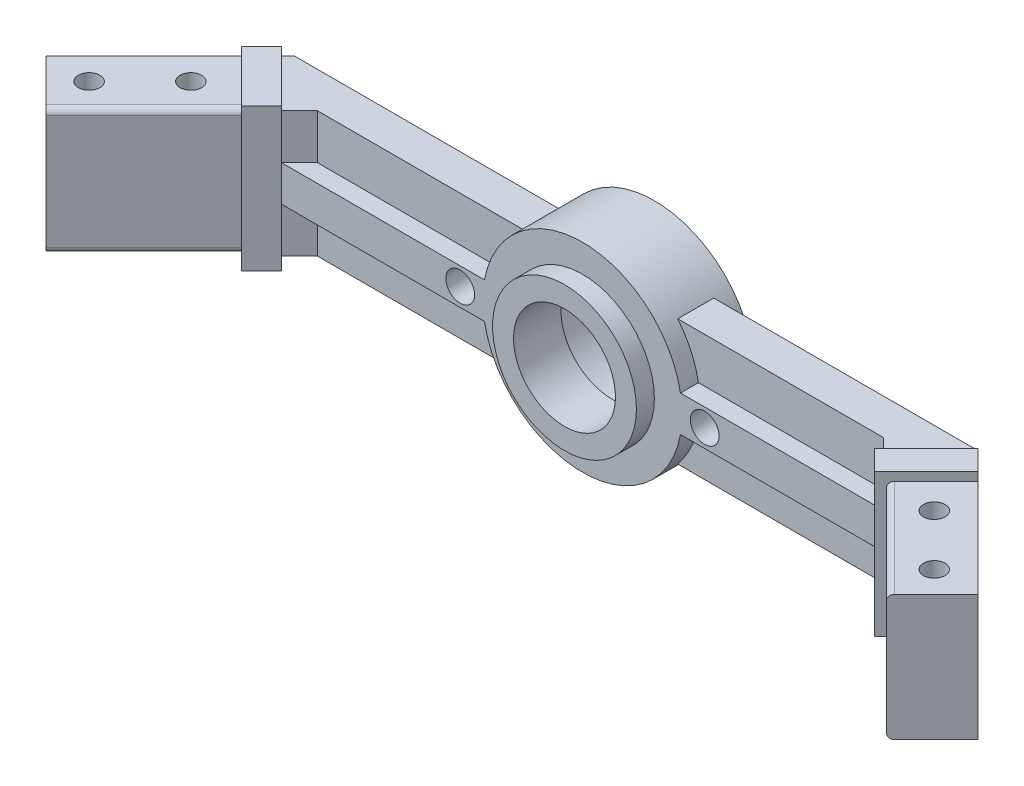
from build123d import *
from build123d.topology import SkipClean

# Parameters (mm, degrees)
BOSS_EXTRUDE1_DEPTH = 11.1125
SKETCH3_R           = 17.6
BOSS_EXTRUDE2_DEPTH = 12.7
SKETCH3_5_R         = 11.25
CUT_EXTRUDE2_DEPTH  = 7.5
SKETCH3_6_R         = 9
CUT_EXTRUDE3_DEPTH  = 12.7
BOSS_EXTRUDE3_START = -31.9278
BOSS_EXTRUDE3_DEPTH = 4.953
FILLET1_R           = 1.016
SKETCH5_R           = 1.905
CUT_EXTRUDE4_DEPTH  = 96.510603758
FILLET3_R           = 1.016
CUT_EXTRUDE5_START  = -3.175
CUT_EXTRUDE5_DEPTH  = 3.175
SKETCH9_W           = 10.961249955
SKETCH9_H           = 7.9375
CUT_EXTRUDE6_DEPTH  = 3.175
CUT_EXTRUDE9_DEPTH  = 2.54
SKETCH13_R          = 12.7
SKETCH13_R_2        = 9
BOSS_EXTRUDE6_DEPTH = 3.175
CHAMFER2_SIZE       = 3.175
SKETCH15_R          = 2.54
CUT_EXTRUDE10_DEPTH = 91.477679673


with BuildPart() as part:
    # Sketch2 → Boss-Extrude1 (new, symmetric)
    with BuildSketch(Plane(origin=(0, 0, 0), x_dir=(1, 0, 0), z_dir=(0, 1, 0))):
        Polygon((0, 0), (-57.15, 0), (-84.090768363, -26.940768363), (-76.008537854, -35.022998872), (-53.685538982, -12.7), (0, -12.7), align=None)
        Polygon((57.15, 0), (0, 0), (0, -12.7), (53.685538982, -12.7), (76.008537854, -35.022998872), (84.090768363, -26.940768363), align=None)
    extrude(amount=BOSS_EXTRUDE1_DEPTH, both=True)

    # Sketch3 → Boss-Extrude2 (add)
    with BuildSketch(Plane(origin=(0, 0, 0), x_dir=(-1, 0, 0), z_dir=(0, 0, -1))):
        Circle(SKETCH3_R)
    extrude(amount=-BOSS_EXTRUDE2_DEPTH)

    # Sketch3<5> → Cut-Extrude2 (cut)
    with BuildSketch(Plane(origin=(0, 0, 0), x_dir=(-1, 0, 0), z_dir=(0, 0, -1))):
        Circle(SKETCH3_5_R)
    extrude(amount=-CUT_EXTRUDE2_DEPTH, mode=Mode.SUBTRACT)

    # Sketch3<6> → Cut-Extrude3 (cut)
    with BuildSketch(Plane(origin=(0, 0, 0), x_dir=(-1, 0, 0), z_dir=(0, 0, -1))):
        Circle(SKETCH3_6_R)
    extrude(amount=-CUT_EXTRUDE3_DEPTH, mode=Mode.SUBTRACT)

    # Sketch4 → Boss-Extrude3 (add)
    with BuildSketch(Plane(origin=(55.515768363, 0, 55.515768363), x_dir=(0.707106781186549, 0, -0.707106781186546), z_dir=(0.707106781186546, 0, 0.707106781186549)).offset(BOSS_EXTRUDE3_START)):
        Polygon((27.481152545, -12.6125), (40.411152545, -12.6125), (40.411152545, -11.1125), (28.981152545, -11.1125), (28.981152545, 11.1125), (40.411152545, 11.1125), (40.411152545, 12.6125), (27.481152545, 12.6125), align=None)
    boss_extrude3 = extrude(amount=BOSS_EXTRUDE3_DEPTH)

    # Fillet1
    fillet1_edges = [part.edges().sort_by_distance(p)[0] for p in [
        (66.471505854, -11.1125, 25.485966872),
        (66.471505854, 11.1125, 25.485966872),
    ]]
    fillet(fillet1_edges, radius=FILLET1_R)

    # Sketch5 → Cut-Extrude4 (cut, through all)
    with BuildSketch(Plane(origin=(0, 11.1125, 0), x_dir=(1, 0, 0), z_dir=(0, 1, 0))):
        with BuildLine():
            ThreePointArc((73.278539993, -23.851560258), (73.278539993, -26.545637094), (75.97261683, -26.545637094))
            Line((75.97261683, -26.545637094), (73.278539993, -23.851560258))
        make_face()
        with BuildLine():
            Line((73.278539993, -23.851560258), (75.97261683, -26.545637094))
            ThreePointArc((75.97261683, -26.545637094), (76.385568921, -25.927610614), (76.530578412, -25.198598676))
            ThreePointArc((76.530578412, -25.198598676), (75.35459035, -23.438608166), (73.278539993, -23.851560258))
        make_face()
        with Locations(Location((65.645322291, -16.218342555, 0), (0, 0, 270))):
            Circle(SKETCH5_R)
    cut_extrude4 = extrude(amount=-CUT_EXTRUDE4_DEPTH, mode=Mode.SUBTRACT)

    # Mirror2: Boss-Extrude3, Cut-Extrude4 across plane
    add(boss_extrude3.mirror(Plane(origin=(0, 0, 0), x_dir=(0, 0, 1), z_dir=(1, 0, 0))))
    add(cut_extrude4.mirror(Plane(origin=(0, 0, 0), x_dir=(0, 0, 1), z_dir=(1, 0, 0))), mode=Mode.SUBTRACT)

    # Fillet3
    fillet3_edges = [part.edges().sort_by_distance(p)[0] for p in [
        (-66.471505854, -11.1125, 25.485966872),
        (-66.471505854, 11.1125, 25.485966872),
    ]]
    fillet(fillet3_edges, radius=FILLET3_R)

    # Sketch6 → Cut-Extrude5 (cut)
    with BuildSketch(Plane.XY.offset(12.7).offset(CUT_EXTRUDE5_START)):
        with BuildLine():
            Line((-53.17880895, 11.1125), (-53.17880895, 3.175))
            Line((-53.17880895, 3.175), (-17.311249955, 3.175))
            ThreePointArc((-17.311249955, 3.175), (-15.980371829, 7.374802791), (-13.648162651, 11.1125))
            Line((-13.648162651, 11.1125), (-53.17880895, 11.1125))
        make_face()
        with BuildLine():
            Line((-17.311249955, -3.175), (-53.17880895, -3.175))
            Line((-53.17880895, -3.175), (-53.17880895, -11.1125))
            Line((-53.17880895, -11.1125), (-13.648162651, -11.1125))
            ThreePointArc((-13.648162651, -11.1125), (-15.980371829, -7.374802791), (-17.311249955, -3.175))
        make_face()
        with BuildLine():
            Line((53.17880895, 11.1125), (13.648162651, 11.1125))
            ThreePointArc((13.648162651, 11.1125), (15.980371829, 7.374802791), (17.311249955, 3.175))
            Line((17.311249955, 3.175), (53.17880895, 3.175))
            Line((53.17880895, 3.175), (53.17880895, 11.1125))
        make_face()
        with BuildLine():
            ThreePointArc((17.311249955, -3.175), (15.980371829, -7.374802791), (13.648162651, -11.1125))
            Line((13.648162651, -11.1125), (53.17880895, -11.1125))
            Line((53.17880895, -11.1125), (53.17880895, -3.175))
            Line((53.17880895, -3.175), (17.311249955, -3.175))
        make_face()
    extrude(amount=CUT_EXTRUDE5_DEPTH, mode=Mode.SUBTRACT)

    # Sketch9 → Cut-Extrude6 (cut)
    with SkipClean():  # the faces are left unmerged after this step: merging them gives an invalid solid
        with BuildSketch(Plane(origin=(0, 0, 0), x_dir=(-1, 0, 0), z_dir=(0, 0, -1))):
            with Locations((62.630624978, -7.14375)):
                Rectangle(SKETCH9_W, SKETCH9_H)
            with BuildLine():
                ThreePointArc((17.311249955, -3.175), (15.980371829, -7.374802791), (13.648162651, -11.1125))
                Line((13.648162651, -11.1125), (57.15, -11.1125))
                Line((57.15, -11.1125), (57.15, -3.175))
                Line((57.15, -3.175), (17.311249955, -3.175))
            make_face()
            with BuildLine():
                Line((57.15, 11.1125), (13.648162651, 11.1125))
                ThreePointArc((13.648162651, 11.1125), (15.980371829, 7.374802791), (17.311249955, 3.175))
                Line((17.311249955, 3.175), (57.15, 3.175))
                Line((57.15, 3.175), (57.15, 11.1125))
            make_face()
            with Locations((62.630624978, 7.14375)):
                Rectangle(SKETCH9_W, SKETCH9_H)
            with BuildLine():
                ThreePointArc((-13.648162651, -11.1125), (-15.980371829, -7.374802791), (-17.311249955, -3.175))
                Line((-17.311249955, -3.175), (-57.15, -3.175))
                Line((-57.15, -3.175), (-57.15, -11.1125))
                Line((-57.15, -11.1125), (-13.648162651, -11.1125))
            make_face()
            with Locations((-62.630624978, -7.14375)):
                Rectangle(SKETCH9_W, SKETCH9_H)
            with BuildLine():
                Line((-57.15, 3.175), (-17.311249955, 3.175))
                ThreePointArc((-17.311249955, 3.175), (-15.980371829, 7.374802791), (-13.648162651, 11.1125))
                Line((-13.648162651, 11.1125), (-57.15, 11.1125))
                Line((-57.15, 11.1125), (-57.15, 3.175))
            make_face()
            with Locations((-62.630624978, 7.14375)):
                Rectangle(SKETCH9_W, SKETCH9_H)
        extrude(amount=-CUT_EXTRUDE6_DEPTH, mode=Mode.SUBTRACT)

    # Sketch12 → Cut-Extrude9 (cut)
    with SkipClean():  # the faces are left unmerged after this step: merging them gives an invalid solid
        with BuildSketch(Plane(origin=(55.515768363, 0, 55.515768363), x_dir=(0.7071067811865486, 0, -0.7071067811865465), z_dir=(0.7071067811865465, 0, 0.7071067811865486))):
            with BuildLine():
                Line((28.981152545, 10.0965), (28.981152545, -10.0965))
                ThreePointArc((28.981152545, -10.0965), (29.278732055, -10.81492049), (29.997152545, -11.1125))
                Line((29.997152545, -11.1125), (40.411152545, -11.1125))
                Line((40.411152545, -11.1125), (40.411152545, 11.1125))
                Line((40.411152545, 11.1125), (29.997152545, 11.1125))
                ThreePointArc((29.997152545, 11.1125), (29.278732055, 10.81492049), (28.981152545, 10.0965))
            make_face()
        cut_extrude9 = extrude(amount=-CUT_EXTRUDE9_DEPTH, mode=Mode.SUBTRACT)

    # Mirror3: Cut-Extrude9 across plane
    with SkipClean():  # the faces are left unmerged after this step: merging them gives an invalid solid
        add(cut_extrude9.mirror(Plane(origin=(0, 0, 0), x_dir=(0, 0, 1), z_dir=(1, 0, 0))), mode=Mode.SUBTRACT)

    # Sketch13 → Boss-Extrude6 (add)
    with SkipClean():  # the faces are left unmerged after this step: merging them gives an invalid solid
        with BuildSketch(Plane.XY.offset(12.7)):
            Circle(SKETCH13_R)
            with Locations(Location((0, 0, 0), (0, 0, 180))):
                Circle(SKETCH13_R_2, mode=Mode.SUBTRACT)
        extrude(amount=BOSS_EXTRUDE6_DEPTH)

    # Chamfer2
    chamfer2_edges = [part.edges().sort_by_distance(p)[0] for p in [
        (53.17880895, 7.14375, 9.525),
        (53.17880895, -7.14375, 9.525),
        (-53.17880895, 7.14375, 9.525),
        (-53.17880895, -7.14375, 9.525),
    ]]
    chamfer(chamfer2_edges, length=CHAMFER2_SIZE - 0.0001)  # a hair under: the kernel refuses the full size

    # Sketch15 → Cut-Extrude10 (cut, through all)
    with BuildSketch(Plane(origin=(0, 0, 0), x_dir=(-1, 0, 0), z_dir=(0, 0, -1))):
        with Locations((21.59, 0)):
            Circle(SKETCH15_R)
        with Locations(Location((-21.59, 0, 0), (0, 0, 180))):
            Circle(SKETCH15_R)
    extrude(amount=-CUT_EXTRUDE10_DEPTH, mode=Mode.SUBTRACT)


solid = part.part
